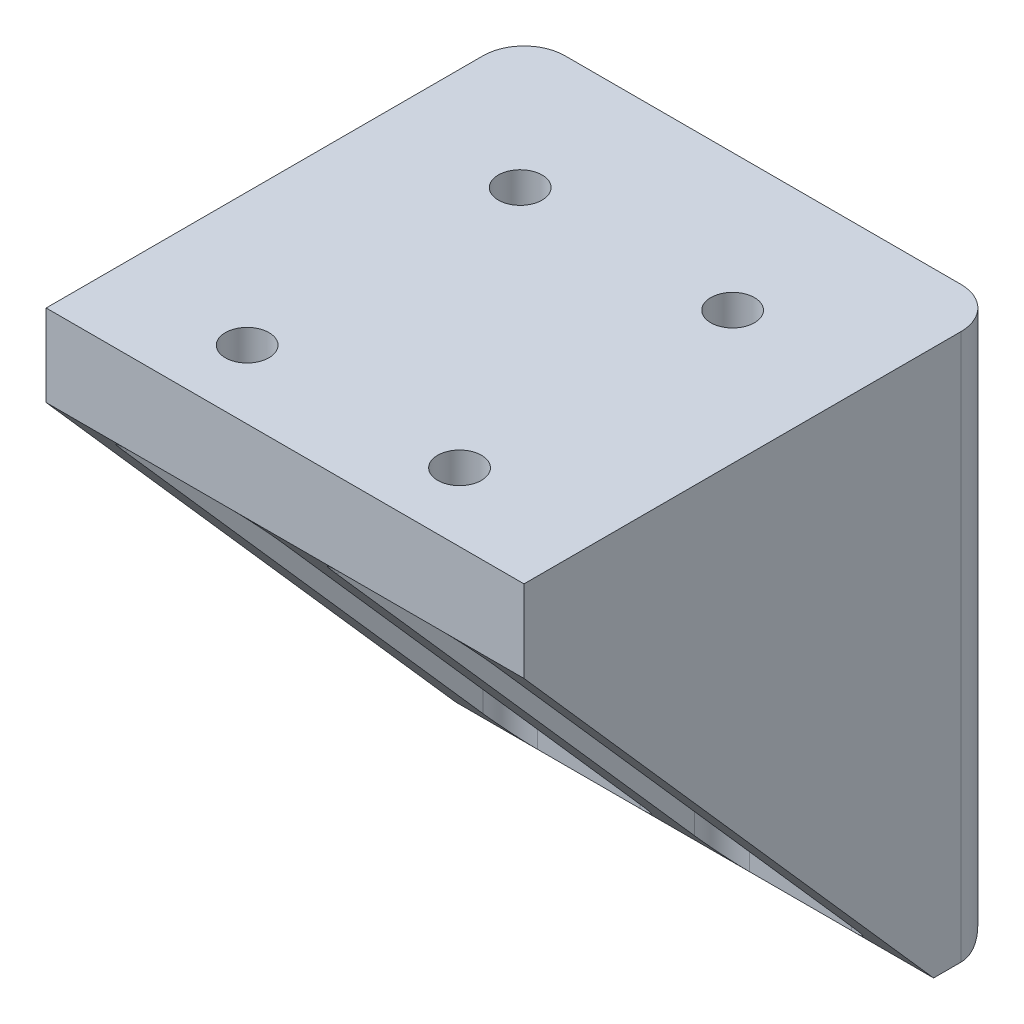
from build123d import *

# Parameters (mm, degrees)
SKETCH3_W                = 35
SKETCH3_H                = 40
BOSS_EXTRUDE1_DEPTH      = 5
SKETCH5_W                = 35
SKETCH5_H                = 30
BOSS_EXTRUDE2_DEPTH      = 6
BOSS_EXTRUDE3_DEPTH      = 4
BOSS_EXTRUDE4_DEPTH      = 2
BOSS_EXTRUDE4_DEPTH_BACK = 2
SKETCH9_R                = 1.05
CUT_EXTRUDE1_DEPTH       = 5
SKETCH10_R               = 1.6
CUT_EXTRUDE2_DEPTH       = 56.957573214
FILLET1_R                = 3
FILLET2_R                = 2


with BuildPart() as part:
    # Sketch3 → Boss-Extrude1 (new body)
    with BuildSketch(Plane.XY):
        Rectangle(SKETCH3_W, SKETCH3_H)
    extrude(amount=BOSS_EXTRUDE1_DEPTH)

    # Sketch5 → Boss-Extrude2 (add)
    with BuildSketch(Plane(origin=(0, 20, 0), x_dir=(1, 0, 0), z_dir=(0, 1, 0))):
        with Locations((0, -20)):
            Rectangle(SKETCH5_W, SKETCH5_H)
    extrude(amount=-BOSS_EXTRUDE2_DEPTH)

    # Sketch7 → Boss-Extrude3 (add)
    with BuildSketch(Plane(origin=(17.5, 0, 0), x_dir=(0, 0, -1), z_dir=(1, 0, 0))):
        Polygon((-35, 14), (-5, -20), (-5, 14), align=None)
    boss_extrude3 = extrude(amount=-BOSS_EXTRUDE3_DEPTH)

    # Mirror1: Boss-Extrude3 across plane
    add(boss_extrude3.mirror(Plane(origin=(0, 0, 0), x_dir=(0, 0, 1), z_dir=(1, 0, 0))))

    # Sketch8 → Boss-Extrude4 (add, two sides: drawn at the far end of the back side and taken through both)
    with BuildSketch(Plane(origin=(0, 0, 0), x_dir=(0, 0, -1), z_dir=(1, 0, 0)).offset(-BOSS_EXTRUDE4_DEPTH_BACK)):
        Polygon((-35, 14), (-5, -20), (-5, 14), align=None)
    extrude(amount=BOSS_EXTRUDE4_DEPTH + BOSS_EXTRUDE4_DEPTH_BACK)

    # Sketch9 → Cut-Extrude1 (cut)
    with BuildSketch(Plane(origin=(0, 0, 0), x_dir=(-1, 0, 0), z_dir=(0, 0, -1))):
        with Locations((-7.778174593, 7.778174593)):
            Circle(SKETCH9_R)
        with Locations((7.778174593, 7.778174593)):
            Circle(SKETCH9_R)
        with Locations((7.778174593, -7.778174593)):
            Circle(SKETCH9_R)
        with Locations((-7.778174593, -7.778174593)):
            Circle(SKETCH9_R)
    extrude(amount=-CUT_EXTRUDE1_DEPTH, mode=Mode.SUBTRACT)

    # Sketch10 → Cut-Extrude2 (cut, through all)
    with BuildSketch(Plane(origin=(0, 20, 0), x_dir=(1, 0, 0), z_dir=(0, 1, 0))):
        with Locations(Location((-7.778174593, -10, 0), (0, 0, 180))):
            Circle(SKETCH10_R)
        with Locations(Location((-7.778174593, -30, 0), (0, 0, 180))):
            Circle(SKETCH10_R)
        with Locations(Location((7.778174593, -30, 0), (0, 0, 180))):
            Circle(SKETCH10_R)
        with Locations(Location((7.778174593, -10, 0), (0, 0, 180))):
            Circle(SKETCH10_R)
    extrude(amount=-CUT_EXTRUDE2_DEPTH, mode=Mode.SUBTRACT)

    # Fillet1
    fillet1_edges = [part.edges().sort_by_distance(p)[0] for p in [
        (0, -20, 0),
        (-17.5, 0, 0),
        (17.5, 0, 0),
    ]]
    fillet(fillet1_edges, radius=FILLET1_R)

    # Fillet2
    # the kernel refuses this fillet: 2 mm, written as the material it adds along each edge
    with BuildSketch(Plane(origin=(13.5, 14, 0), x_dir=(0, -1, 0), z_dir=(0, 0, 1))) as fillet2_piece_1_section:
        with BuildLine():
            CenterArc((FILLET2_R, -FILLET2_R), FILLET2_R, 90, 90)
            Line((0, -FILLET2_R), (0, 0))
            Line((0, 0), (FILLET2_R, 0))
        make_face()
    fillet2_piece_1 = extrude(amount=35, mode=Mode.PRIVATE)
    fillet2_piece_1 = split(fillet2_piece_1, bisect_by=Plane(origin=(13.047209771, -2.378125245, 20.548713019), z_dir=(0, 0.6616216370868465, -0.7498378553650924)), keep=Keep.TOP, mode=Mode.PRIVATE)
    add(fillet2_piece_1)
    with BuildSketch(Plane(origin=(13.5, -20, 5), x_dir=(-1, 0, 0), z_dir=(0, 1, 0))) as fillet2_piece_2_section:
        with BuildLine():
            CenterArc((FILLET2_R, FILLET2_R), FILLET2_R, 180, 90)
            Line((0, FILLET2_R), (0, 0))
            Line((0, 0), (FILLET2_R, 0))
        make_face()
    fillet2_piece_2 = extrude(amount=39, mode=Mode.PRIVATE)
    fillet2_piece_2 = split(fillet2_piece_2, bisect_by=Plane(origin=(13.043521125, -10.077324079, 13.755302283), z_dir=(0, 0.6616216370868465, -0.7498378553650924)), keep=Keep.TOP, mode=Mode.PRIVATE)
    add(fillet2_piece_2)
    with BuildSketch(Plane(origin=(-13.5, 14, 0), x_dir=(0, -1, 0), z_dir=(0, 0, 1))) as fillet2_piece_3_section:
        with BuildLine():
            CenterArc((FILLET2_R, FILLET2_R), FILLET2_R, 180, 90)
            Line((0, FILLET2_R), (0, 0))
            Line((0, 0), (FILLET2_R, 0))
        make_face()
    fillet2_piece_3 = extrude(amount=35, mode=Mode.PRIVATE)
    fillet2_piece_3 = split(fillet2_piece_3, bisect_by=Plane(origin=(-13.047209771, -2.378125245, 20.548713019), z_dir=(0, 0.6616216370868465, -0.7498378553650924)), keep=Keep.TOP, mode=Mode.PRIVATE)
    add(fillet2_piece_3)
    with BuildSketch(Plane(origin=(-13.5, -20, 5), x_dir=(1, 0, 0), z_dir=(0, 1, 0))) as fillet2_piece_4_section:
        with BuildLine():
            CenterArc((FILLET2_R, -FILLET2_R), FILLET2_R, 90, 90)
            Line((0, -FILLET2_R), (0, 0))
            Line((0, 0), (FILLET2_R, 0))
        make_face()
    fillet2_piece_4 = extrude(amount=39, mode=Mode.PRIVATE)
    fillet2_piece_4 = split(fillet2_piece_4, bisect_by=Plane(origin=(-13.043521125, -10.077324079, 13.755302283), z_dir=(0, 0.6616216370868465, -0.7498378553650924)), keep=Keep.TOP, mode=Mode.PRIVATE)
    add(fillet2_piece_4)
    with BuildSketch(Plane(origin=(-2, 14, 0), x_dir=(-1, 0, 0), z_dir=(0, 0, 1))) as fillet2_piece_5_section:
        with BuildLine():
            CenterArc((FILLET2_R, FILLET2_R), FILLET2_R, 180, 90)
            Line((0, FILLET2_R), (0, 0))
            Line((0, 0), (FILLET2_R, 0))
        make_face()
    fillet2_piece_5 = extrude(amount=35, mode=Mode.PRIVATE)
    fillet2_piece_5 = split(fillet2_piece_5, bisect_by=Plane(origin=(-2.452790229, -2.378125245, 20.548713019), z_dir=(0, 0.6616216370868465, -0.7498378553650924)), keep=Keep.TOP, mode=Mode.PRIVATE)
    add(fillet2_piece_5)
    with BuildSketch(Plane(origin=(-2, -20, 5), x_dir=(-1, 0, 0), z_dir=(0, 1, 0))) as fillet2_piece_6_section:
        with BuildLine():
            CenterArc((FILLET2_R, FILLET2_R), FILLET2_R, 180, 90)
            Line((0, FILLET2_R), (0, 0))
            Line((0, 0), (FILLET2_R, 0))
        make_face()
    fillet2_piece_6 = extrude(amount=39, mode=Mode.PRIVATE)
    fillet2_piece_6 = split(fillet2_piece_6, bisect_by=Plane(origin=(-2.456478875, -10.077324079, 13.755302283), z_dir=(0, 0.6616216370868465, -0.7498378553650924)), keep=Keep.TOP, mode=Mode.PRIVATE)
    add(fillet2_piece_6)
    with BuildSketch(Plane(origin=(2, 14, 0), x_dir=(0, -1, 0), z_dir=(0, 0, 1))) as fillet2_piece_7_section:
        with BuildLine():
            CenterArc((FILLET2_R, FILLET2_R), FILLET2_R, 180, 90)
            Line((0, FILLET2_R), (0, 0))
            Line((0, 0), (FILLET2_R, 0))
        make_face()
    fillet2_piece_7 = extrude(amount=35, mode=Mode.PRIVATE)
    fillet2_piece_7 = split(fillet2_piece_7, bisect_by=Plane(origin=(2.452790229, -2.378125245, 20.548713019), z_dir=(0, 0.6616216370868465, -0.7498378553650924)), keep=Keep.TOP, mode=Mode.PRIVATE)
    add(fillet2_piece_7)
    with BuildSketch(Plane(origin=(2, -20, 5), x_dir=(1, 0, 0), z_dir=(0, 1, 0))) as fillet2_piece_8_section:
        with BuildLine():
            CenterArc((FILLET2_R, -FILLET2_R), FILLET2_R, 90, 90)
            Line((0, -FILLET2_R), (0, 0))
            Line((0, 0), (FILLET2_R, 0))
        make_face()
    fillet2_piece_8 = extrude(amount=39, mode=Mode.PRIVATE)
    fillet2_piece_8 = split(fillet2_piece_8, bisect_by=Plane(origin=(2.456478875, -10.077324079, 13.755302283), z_dir=(0, 0.6616216370868465, -0.7498378553650924)), keep=Keep.TOP, mode=Mode.PRIVATE)
    add(fillet2_piece_8)


solid = part.part
